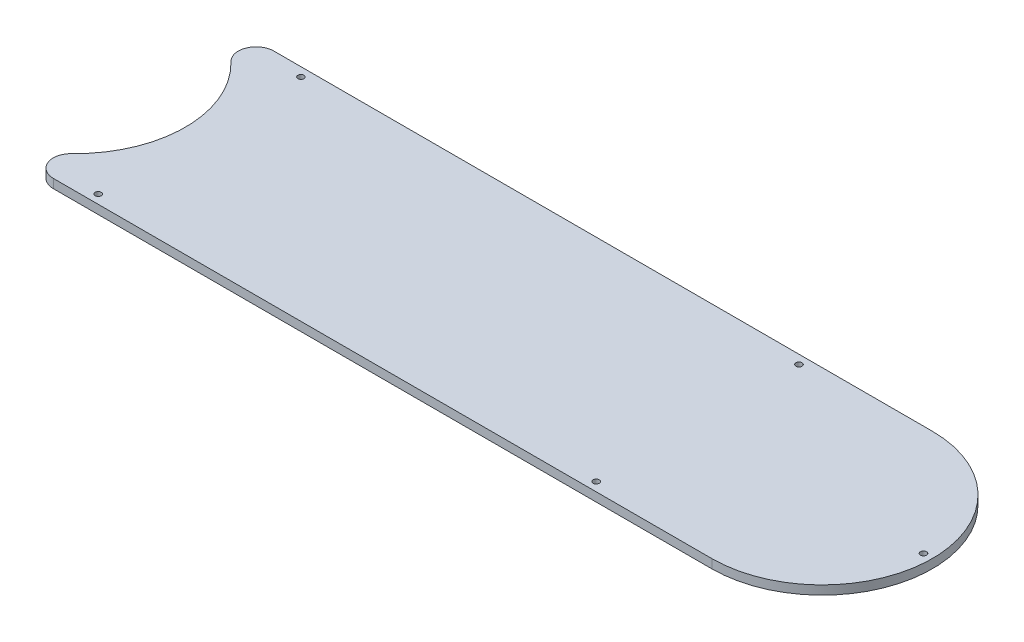
from build123d import *

# Parameters (mm, degrees)
SKETCH1_R           = 1.0922
BOSS_EXTRUDE1_DEPTH = 3.175
FILLET1_R           = 6.35


with BuildPart() as part:
    # Sketch1 → Boss-Extrude1 (new body)
    with BuildSketch(Plane(origin=(0, 0, 0), x_dir=(1, 0, 0), z_dir=(0, 1, 0))):
        with BuildLine():
            Line((266.7, 39.37), (0, 39.37))
            ThreePointArc((0, 39.37), (39.37, 0), (0, -39.37))
            Line((0, -39.37), (266.7, -39.37))
            ThreePointArc((266.7, -39.37), (306.07, 0), (266.7, 39.37))
        make_face()
        with Locations((302.895, 0)):
            Circle(SKETCH1_R, mode=Mode.SUBTRACT)
        with Locations((222.25, 36.195)):
            Circle(SKETCH1_R, mode=Mode.SUBTRACT)
        with Locations((44.45, 36.195)):
            Circle(SKETCH1_R, mode=Mode.SUBTRACT)
        with Locations((44.45, -36.195)):
            Circle(SKETCH1_R, mode=Mode.SUBTRACT)
        with Locations((222.25, -36.195)):
            Circle(SKETCH1_R, mode=Mode.SUBTRACT)
    extrude(amount=BOSS_EXTRUDE1_DEPTH)

    # Fillet1
    fillet1_edges = [part.edges().sort_by_distance(p)[0] for p in [
        (0, 1.5875, 39.37),
        (0, 1.5875, -39.37),
    ]]
    fillet(fillet1_edges, radius=FILLET1_R)


solid = part.part
